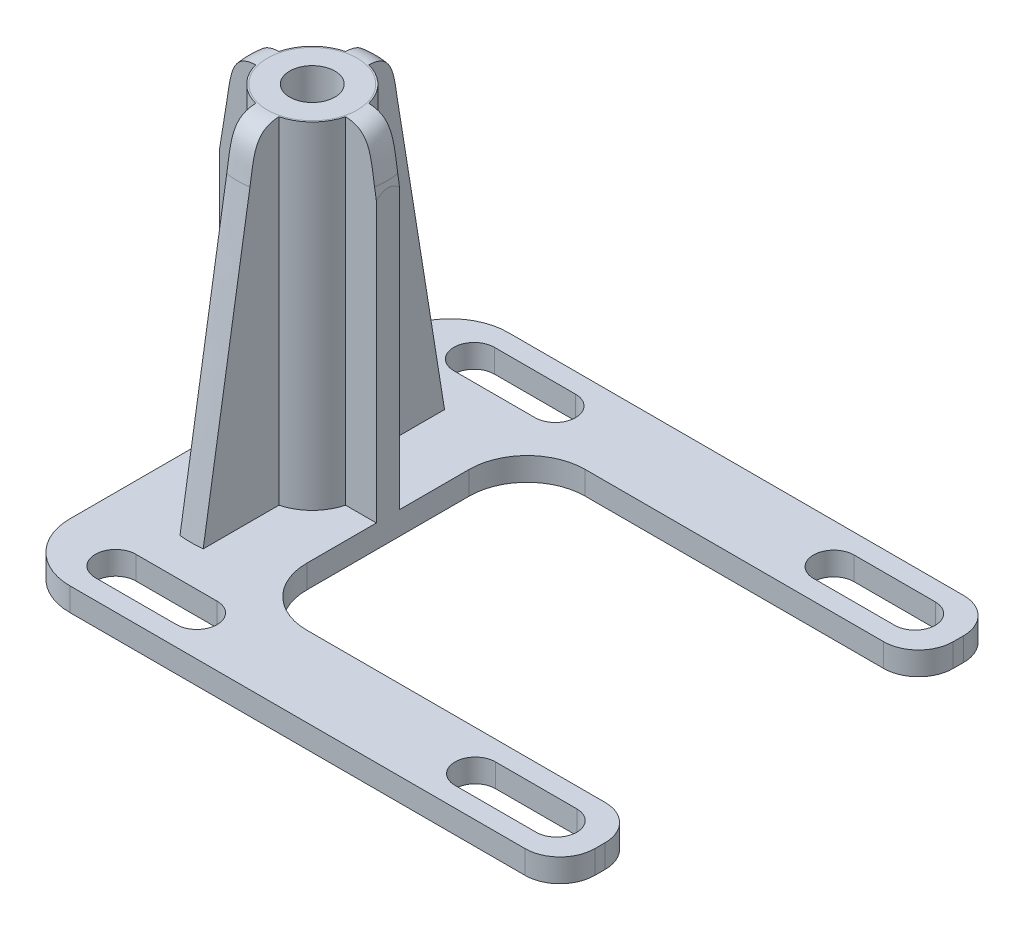
from build123d import *

# Parameters (mm, degrees)
BOSS_EXTRUDE1_DEPTH = 2
FILLET1_R           = 5
FILLET2_R           = 3
SKETCH2_R           = 1.95
BOSS_EXTRUDE2_DEPTH = 29


with BuildPart() as part:
    # Sketch1 → Boss-Extrude1 (new body)
    with BuildSketch(Plane(origin=(0, 0, 0), x_dir=(1, 0, 0), z_dir=(0, 1, 0))):
        Polygon((47.24332582, 30.9), (47.24332582, 37.8), (0, 37.8), (0, 0), (47.24332582, 0), (47.24332582, 6.9), (13.518849419, 6.9), (13.518849419, 30.9), align=None)
        with BuildLine():
            Line((5.49332582, 36.1), (12.49332582, 36.1))
            ThreePointArc((12.49332582, 36.1), (14.24332582, 34.35), (12.49332582, 32.6))
            Line((12.49332582, 32.6), (5.49332582, 32.6))
            ThreePointArc((5.49332582, 32.6), (3.74332582, 34.35), (5.49332582, 36.1))
        make_face(mode=Mode.SUBTRACT)
        with BuildLine():
            Line((36.49332582, 36.1), (43.49332582, 36.1))
            ThreePointArc((43.49332582, 36.1), (45.24332582, 34.35), (43.49332582, 32.6))
            Line((43.49332582, 32.6), (36.49332582, 32.6))
            ThreePointArc((36.49332582, 32.6), (34.74332582, 34.35), (36.49332582, 36.1))
        make_face(mode=Mode.SUBTRACT)
        with BuildLine():
            Line((5.49332582, 5.2), (12.49332582, 5.2))
            ThreePointArc((12.49332582, 5.2), (14.24332582, 3.45), (12.49332582, 1.7))
            Line((12.49332582, 1.7), (5.49332582, 1.7))
            ThreePointArc((5.49332582, 1.7), (3.74332582, 3.45), (5.49332582, 5.2))
        make_face(mode=Mode.SUBTRACT)
        with BuildLine():
            Line((36.49332582, 5.2), (43.49332582, 5.2))
            ThreePointArc((43.49332582, 5.2), (45.24332582, 3.45), (43.49332582, 1.7))
            Line((43.49332582, 1.7), (36.49332582, 1.7))
            ThreePointArc((36.49332582, 1.7), (34.74332582, 3.45), (36.49332582, 5.2))
        make_face(mode=Mode.SUBTRACT)
    extrude(amount=BOSS_EXTRUDE1_DEPTH)

    # Fillet1
    fillet1_edges = [part.edges().sort_by_distance(p)[0] for p in [
        (0, 1, -37.8),
        (0, 1, 0),
        (13.518849419, 1, -6.9),
        (13.518849419, 1, -30.9),
    ]]
    fillet(fillet1_edges, radius=FILLET1_R)

    # Fillet2
    fillet2_edges = [part.edges().sort_by_distance(p)[0] for p in [
        (47.24332582, 1, -6.9),
        (47.24332582, 1, 0),
        (47.24332582, 1, -30.9),
        (47.24332582, 1, -37.8),
    ]]
    fillet(fillet2_edges, radius=FILLET2_R)

    # Sketch2 → Boss-Extrude2 (add)
    with BuildSketch(Plane(origin=(0, 2, 0), x_dir=(1, 0, 0), z_dir=(0, 1, 0))):
        with BuildLine():
            Line((5.99332582, 22.772983346), (5.99332582, 29.35))
            Line((5.99332582, 29.35), (7.99332582, 29.35))
            Line((7.99332582, 29.35), (7.99332582, 22.772983346))
            ThreePointArc((7.99332582, 22.772983346), (9.821752945, 21.728427125), (10.866309167, 19.9))
            Line((10.866309167, 19.9), (13.518849419, 19.9))
            Line((13.518849419, 19.9), (13.518849419, 17.9))
            Line((13.518849419, 17.9), (10.866309167, 17.9))
            ThreePointArc((10.866309167, 17.9), (9.821752945, 16.071572875), (7.99332582, 15.027016654))
            Line((7.99332582, 15.027016654), (7.99332582, 8.45))
            Line((7.99332582, 8.45), (5.99332582, 8.45))
            Line((5.99332582, 8.45), (5.99332582, 15.027016654))
            ThreePointArc((5.99332582, 15.027016654), (4.164898696, 16.071572875), (3.120342474, 17.9))
            Line((3.120342474, 17.9), (0, 17.9))
            Line((0, 17.9), (0, 19.9))
            Line((0, 19.9), (3.120342474, 19.9))
            ThreePointArc((3.120342474, 19.9), (4.164898696, 21.728427125), (5.99332582, 22.772983346))
        make_face()
        with Locations((6.99332582, 18.9)):
            Circle(SKETCH2_R, mode=Mode.SUBTRACT)
    extrude(amount=BOSS_EXTRUDE2_DEPTH)

    # Sketch4 → Cut-Revolve3 (revolve, cut)
    with BuildSketch(Plane.ZY.offset(-6.99332582)):
        with BuildLine():
            Line((-8.45, 2), (-12.45, 27))
            add(Edge.make_bspline(
                [(-12.45, 27), (-12.79061244, 29.12882775), (-12.803200058, 31), (-15.027016654, 31)],
                knots=[0, 0, 0, 0, 1, 1, 1, 1], degree=3))
            Line((-15.027016654, 31), (-6.9, 31))
            Line((-6.9, 31), (-6.9, 2))
            Line((-6.9, 2), (-8.45, 2))
        make_face()
    revolve(axis=Axis((6.99332582, 0, -18.9), (0, 1, 0)), mode=Mode.SUBTRACT)


solid = part.part
